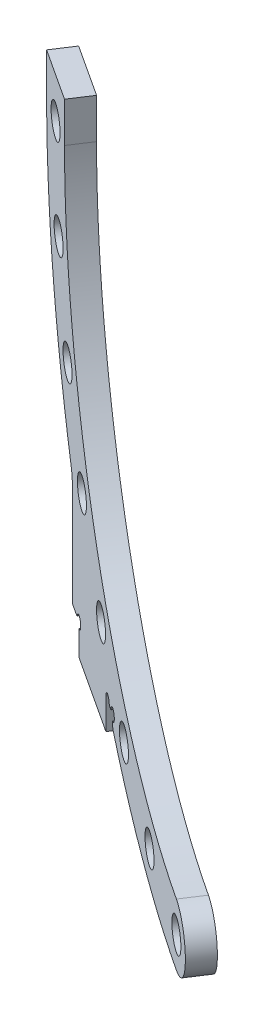
from build123d import *

# Parameters (mm, degrees)
EXTRUDE_1_OUTLINE_R = 2
EXTRUDE_1_DEPTH     = 5.1
SKETCH_4_2_R        = 2
CUT_EXTRUDE_1_DEPTH = 2.1
SKETCH_5_R          = 0.75
CUT_EXTRUDE_2_DEPTH = 48.355992497
FILLET_1_R          = 0.5
FILLET_2_R          = 3


with BuildPart() as part:
    # 凸台-拉伸1: read off the stored shape, not the designer's step
    # 凸台-拉伸1 outline → 凸台-拉伸1 (new body)
    with BuildSketch(Plane(origin=(15.11890087, 0, 4.548317805), x_dir=(-0.8371072123201975, 0, -0.5470388606685158), z_dir=(0.5470388606685158, 0, -0.8371072123201975))):
        with BuildLine():
            ThreePointArc((-11.855752449, -22), (-15.855752449, -26), (-11.855752449, -30))
            ThreePointArc((-11.855752449, -30), (2.877521805, -28.097510014), (16.644247551, -22.514849302))
            Line((16.644247551, -22.514849302), (16.644247551, -21))
            Line((16.644247551, -21), (19.644247551, -21))
            Line((19.644247551, -21), (19.644247551, -25))
            Line((19.644247551, -25), (31.644247551, -25))
            Line((31.644247551, -25), (31.644247551, -21))
            Line((31.644247551, -21), (34.644247551, -21))
            Line((34.644247551, -21), (34.644247551, -6.666266023))
            ThreePointArc((34.644247551, -6.666266023), (43.194224844, 9.738017632), (46.144247551, 28))
            Line((46.144247551, 28), (46.144247551, 33.2))
            Line((46.144247551, 33.2), (38.144247551, 33.2))
            Line((38.144247551, 33.2), (38.144247551, 28))
            ThreePointArc((38.144247551, 28), (23.49958661, -7.355339059), (-11.855752449, -22))
        make_face()
        with Locations((-11.855752449, -26)):
            Circle(EXTRUDE_1_OUTLINE_R, mode=Mode.SUBTRACT)
        with Locations((0.160377984, -24.646107258)):
            Circle(EXTRUDE_1_OUTLINE_R, mode=Mode.SUBTRACT)
        with Locations((11.573969463, -20.652318867)):
            Circle(EXTRUDE_1_OUTLINE_R, mode=Mode.SUBTRACT)
        with Locations((21.812696851, -14.218900053)):
            Circle(EXTRUDE_1_OUTLINE_R, mode=Mode.SUBTRACT)
        with Locations((30.363147604, -5.6684493)):
            Circle(EXTRUDE_1_OUTLINE_R, mode=Mode.SUBTRACT)
        with Locations((36.796566418, 4.570278088)):
            Circle(EXTRUDE_1_OUTLINE_R, mode=Mode.SUBTRACT)
        with Locations((40.790354809, 15.983869566)):
            Circle(EXTRUDE_1_OUTLINE_R, mode=Mode.SUBTRACT)
        with Locations((42.144247551, 28)):
            Circle(EXTRUDE_1_OUTLINE_R, mode=Mode.SUBTRACT)
    extrude(amount=EXTRUDE_1_DEPTH)

    # 草图4<2> → 切除-拉伸1 (cut)
    with BuildSketch(Plane(origin=(15.11890087, 0, 4.548317805), x_dir=(-0.8371072123201975, 0, -0.5470388606685158), z_dir=(0.5470388606685158, 0, -0.8371072123201975))):
        with BuildLine():
            Line((19.644247551, -21), (19.644247551, -25))
            Line((19.644247551, -25), (31.644247551, -25))
            Line((31.644247551, -25), (31.644247551, -21))
            Line((31.644247551, -21), (34.644247551, -21))
            Line((34.644247551, -21), (34.644247551, -6.666266023))
            ThreePointArc((34.644247551, -6.666266023), (43.194224844, 9.738017632), (46.144247551, 28))
            Line((46.144247551, 28), (46.144247551, 33.2))
            Line((46.144247551, 33.2), (38.144247551, 33.2))
            Line((38.144247551, 33.2), (38.144247551, 28))
            ThreePointArc((38.144247551, 28), (23.49958661, -7.355339059), (-11.855752449, -22))
            ThreePointArc((-11.855752449, -22), (-15.855752449, -26), (-11.855752449, -30))
            ThreePointArc((-11.855752449, -30), (2.877521805, -28.097510014), (16.644247551, -22.514849302))
            Line((16.644247551, -22.514849302), (16.644247551, -21))
            Line((16.644247551, -21), (19.644247551, -21))
        make_face()
        with Locations((42.144247551, 28)):
            Circle(SKETCH_4_2_R, mode=Mode.SUBTRACT)
        with Locations((40.790354809, 15.983869566)):
            Circle(SKETCH_4_2_R, mode=Mode.SUBTRACT)
        with Locations((36.796566418, 4.570278088)):
            Circle(SKETCH_4_2_R, mode=Mode.SUBTRACT)
        with Locations((30.363147604, -5.6684493)):
            Circle(SKETCH_4_2_R, mode=Mode.SUBTRACT)
        with Locations((21.812696851, -14.218900053)):
            Circle(SKETCH_4_2_R, mode=Mode.SUBTRACT)
        with Locations((11.573969463, -20.652318867)):
            Circle(SKETCH_4_2_R, mode=Mode.SUBTRACT)
        with Locations((0.160377984, -24.646107258)):
            Circle(SKETCH_4_2_R, mode=Mode.SUBTRACT)
        with Locations((-11.855752449, -26)):
            Circle(SKETCH_4_2_R, mode=Mode.SUBTRACT)
    extrude(amount=CUT_EXTRUDE_1_DEPTH, mode=Mode.SUBTRACT)

    # 草图5 → 切除-拉伸2 (cut, through all)
    with BuildSketch(Plane(origin=(5.23144021, 0, -8.005420904), x_dir=(-0.8371072123201976, 0, -0.5470388606685158), z_dir=(0.5470388606685158, 0, -0.8371072123201976))):
        with Locations((3.75, -21)):
            Circle(SKETCH_5_R)
        with Locations((16.5, -21)):
            Circle(SKETCH_5_R)
        with Locations((1.5, -21)):
            Circle(SKETCH_5_R)
    extrude(amount=-CUT_EXTRUDE_2_DEPTH, mode=Mode.SUBTRACT)

    # 圆角1
    fillet_1_edges = [part.edges().sort_by_distance(p)[0] for p in [
        (-10.029217494, -21, -16.186180432),
        (3.1552211, -22.514849302, -7.570318376),
    ]]
    fillet(fillet_1_edges, radius=FILLET_1_R)

    # 圆角2
    fillet_2_edges = [part.edges().sort_by_distance(p)[0] for p in [
        (-11.912708722, -6.666266023, -17.417017868),
    ]]
    fillet(fillet_2_edges, radius=FILLET_2_R)


solid = part.part
